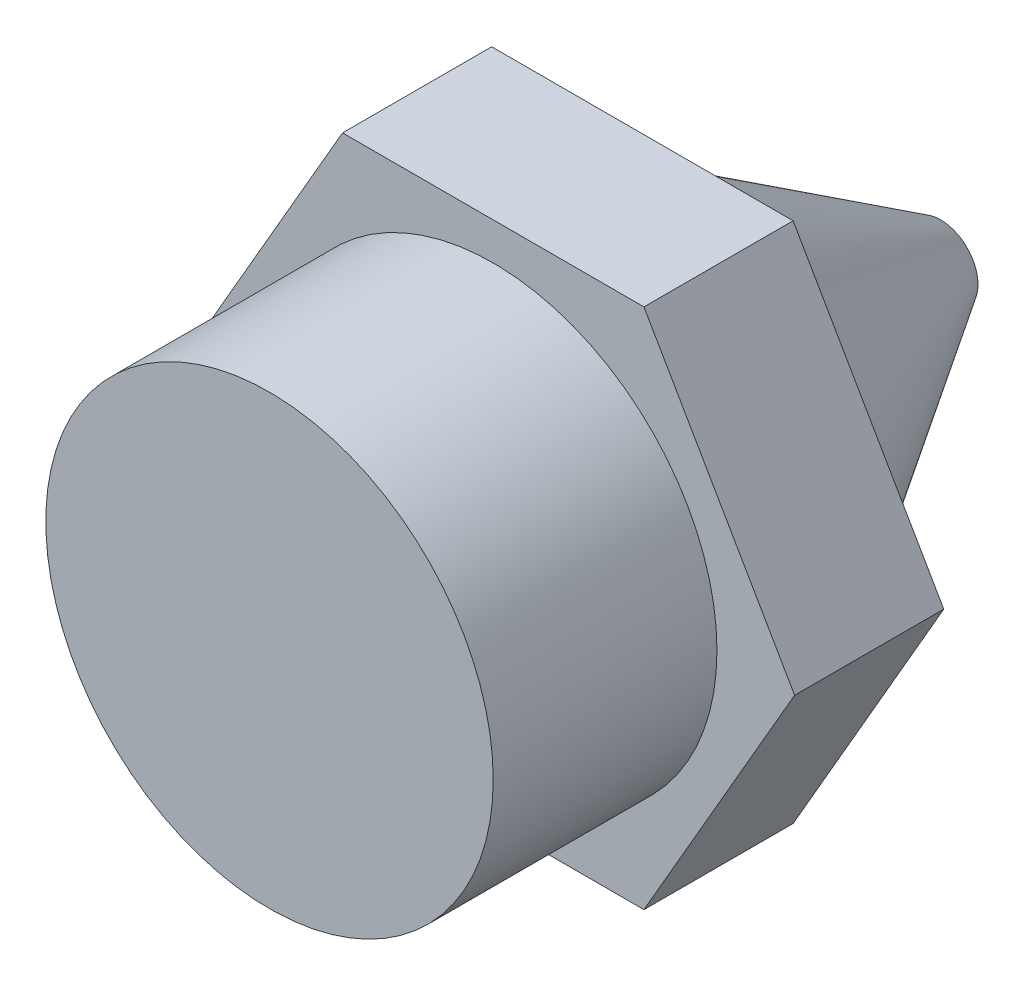
from build123d import *

# Parameters (mm, degrees)
BOSS_EXTRU_1_DEPTH      = 9
ESQUISSE2_W             = 19.623971562
ESQUISSE2_H             = 15.534154535
ESQUISSE2_R             = 3
ENL_V_MAT_EXTRU_1_DEPTH = 3
ENL_V_START             = -4
ESQUISSE3_W             = 11.267201257
ESQUISSE3_H             = 13.961169169
ESQUISSE3_R             = 3
ENL_V_MAT_EXTRU_2_DEPTH = 4
CHANFREIN1_SIZE         = 4
CHANFREIN1_SIZE_2       = 2.499477408


with BuildPart() as part:
    # Esquisse1 → Boss.-Extru.1 (new body)
    with BuildSketch(Plane.XY):
        Polygon((4.041451884, 0), (2.020725942, 3.5), (-2.020725942, 3.5), (-4.041451884, 0), (-2.020725942, -3.5), (2.020725942, -3.5), align=None)
    extrude(amount=BOSS_EXTRU_1_DEPTH)

    # Esquisse2 → Enlèv. mat.-Extru.1 (cut)
    with BuildSketch(Plane.XY.offset(9)):
        with Locations((0.327116653, -1.544441398)):
            Rectangle(ESQUISSE2_W, ESQUISSE2_H)
        Circle(ESQUISSE2_R, mode=Mode.SUBTRACT)
    extrude(amount=-ENL_V_MAT_EXTRU_1_DEPTH, mode=Mode.SUBTRACT)

    # Esquisse3 → Enlèv. mat.-Extru.2 (cut)
    with BuildSketch(Plane(origin=(0, 0, 0), x_dir=(-1, 0, 0), z_dir=(0, 0, -1)).offset(ENL_V_START)):
        with Locations((0.009770186, 0.039262349)):
            Rectangle(ESQUISSE3_W, ESQUISSE3_H)
        with Locations(Location((0, 0, 0), (0, 0, 180))):
            Circle(ESQUISSE3_R, mode=Mode.SUBTRACT)
    extrude(amount=ENL_V_MAT_EXTRU_2_DEPTH, mode=Mode.SUBTRACT)

    # Chanfrein1
    # the kernel refuses this chamfer: 4, 2.499477408 mm, written as the material it takes off along each edge
    with BuildSketch(Plane(origin=(0, 0, 0), x_dir=(1, 0, 0), z_dir=(0, 1, 0))) as chanfrein1_piece_1_section:
        Polygon((3, -CHANFREIN1_SIZE), (3 - CHANFREIN1_SIZE_2, 0), (3, 0), align=None)
    chanfrein1_piece_1 = revolve(axis=Axis((0, 0, 0), (0, 0, -1)), mode=Mode.PRIVATE)
    chanfrein1_piece_1 = split(chanfrein1_piece_1, bisect_by=Plane(origin=(-1.744026904, 0, 4), z_dir=(0, 0, -1)), keep=Keep.TOP, mode=Mode.PRIVATE)
    add(chanfrein1_piece_1, mode=Mode.SUBTRACT)


solid = part.part
